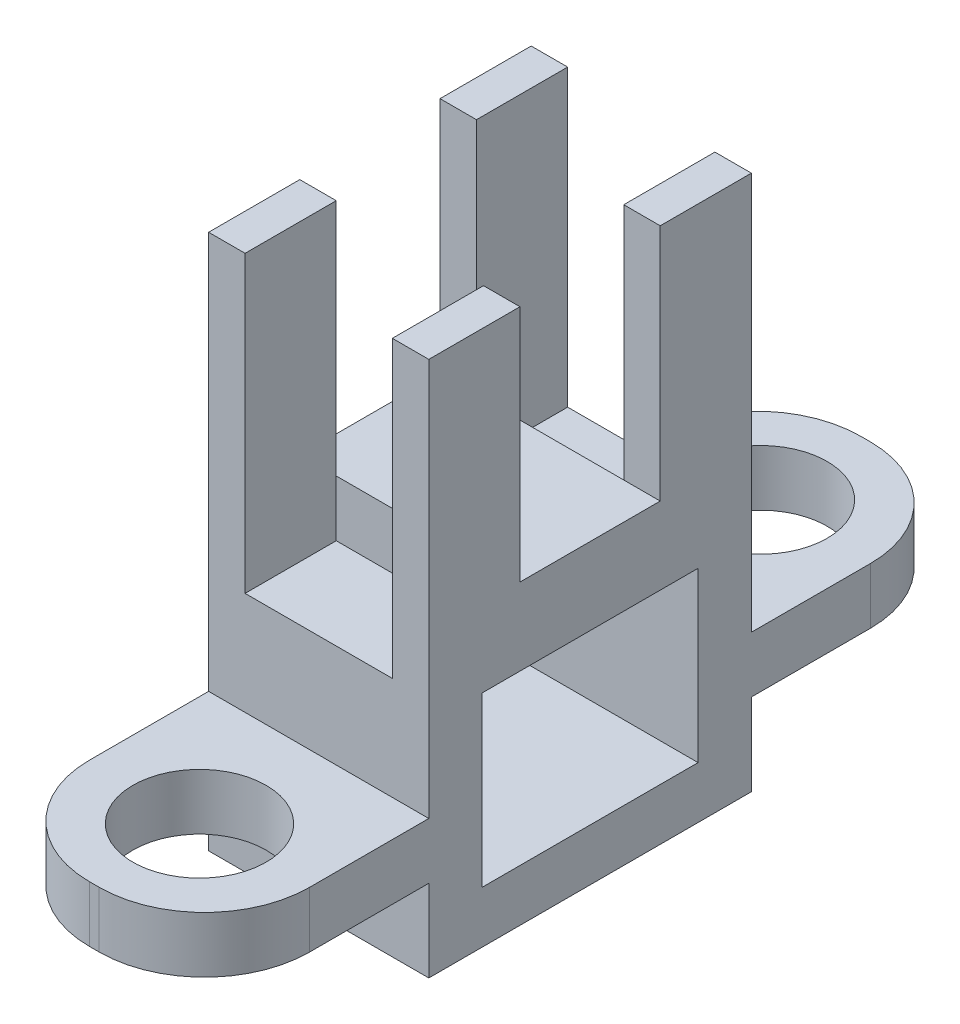
from build123d import *

# Parameters (mm, degrees)
SKETCH4_W             = 31.4
SKETCH4_H             = 31.4
SKETCH4_W_2           = 25.4
SKETCH4_H_2           = 25.4
BOSS_EXTRUDE3_DEPTH   = 30
SKETCH5_W             = 31.4
SKETCH5_H             = 31.4
BOSS_EXTRUDE4_DEPTH   = 5
SKETCH6_W             = 31.4
SKETCH6_H             = 8
BOSS_EXTRUDE5_DEPTH   = 5
BOSS_EXTRUDE6_DEPTH   = 8
SKETCH8_R             = 9.5
BOSS_EXTRUDE7_DEPTH   = 8
SKETCH9_W             = 31.4
SKETCH9_H             = 10
BOSS_EXTRUDE8_DEPTH   = 5
SKETCH10_W            = 31.4
SKETCH10_H            = 10
BOSS_EXTRUDE9_DEPTH   = 11
SKETCH11_W            = 5.2
SKETCH11_H            = 10
BOSS_EXTRUDE10_DEPTH  = 40
BOSS_EXTRUDE11_DEPTH  = 3
SKETCH13_W            = 31.4
SKETCH13_H            = 31.4
CUT_EXTRUDE1_DEPTH    = 31.4
SKETCH14_W            = 31.4
SKETCH14_H            = 31.4
BOSS_EXTRUDE12_DEPTH  = 4
SKETCH16_W            = 31.4
SKETCH16_H            = 8
BOSS_EXTRUDE13_DEPTH  = 15.4
CUT_EXTRUDE3_START    = 8
SKETCH8_2_R           = 9.5
CUT_EXTRUDE3_DEPTH    = 24
SKETCH18_W            = 21
SKETCH18_H            = 13
CUT_EXTRUDE4_DEPTH    = 2
MIRROR2_START         = -15.7
MIRROR2_DEPTH         = 34.4
MIRROR2_START_2       = 12.7
MIRROR2_2_OUTLINE_W   = 5.2
MIRROR2_2_OUTLINE_H   = 13
MIRROR2_2_DEPTH       = 48
MIRROR2_START_3       = -4
MIRROR2_3_OUTLINE_R   = 9.5
MIRROR2_3_DEPTH       = 8
MIRROR2_4_OUTLINE_W   = 31.4
MIRROR2_4_OUTLINE_H   = 10
MIRROR2_4_DEPTH       = 14
MIRROR2_5_OUTLINE_W   = 25.4
MIRROR2_5_OUTLINE_H   = 15.4
MIRROR2_5_DEPTH       = 8
MIRROR2_6_OUTLINE_W   = 21
MIRROR2_6_OUTLINE_H   = 5.4
MIRROR2_6_OUTLINE_W_2 = 25.4
MIRROR2_6_OUTLINE_H_2 = 12
MIRROR2_6_DEPTH       = 6
SKETCH17_W            = 30.8
SKETCH17_H            = 24
CUT_EXTRUDE2_DEPTH    = 31.4


# Read off the part's stored shape, not the designer's step: Mirror2
with BuildPart() as part:
    # Sketch4 → Boss-Extrude3 (new body)
    with BuildSketch(Plane.XY):
        Rectangle(SKETCH4_W, SKETCH4_H)
        Rectangle(SKETCH4_W_2, SKETCH4_H_2, mode=Mode.SUBTRACT)
    extrude(amount=BOSS_EXTRUDE3_DEPTH)

    # Sketch5 → Boss-Extrude4 (add)
    with BuildSketch(Plane.XY.offset(30)):
        Rectangle(SKETCH5_W, SKETCH5_H)
    extrude(amount=BOSS_EXTRUDE4_DEPTH)

    # Sketch6 → Boss-Extrude5 (add)
    with BuildSketch(Plane.XY.offset(35)):
        Rectangle(SKETCH6_W, SKETCH6_H)
    extrude(amount=BOSS_EXTRUDE5_DEPTH)

    # Sketch7 → Boss-Extrude6 (add)
    with BuildSketch(Plane.XZ.offset(4)):
        with BuildLine():
            Line((-15.7, 40), (-15.7, 52))
            ThreePointArc((-15.7, 52), (-11.306601718, 62.606601718), (-0.7, 67))
            Line((-0.7, 67), (0.7, 67))
            ThreePointArc((0.7, 67), (11.306601718, 62.606601718), (15.7, 52))
            Line((15.7, 52), (15.7, 40))
            Line((15.7, 40), (-15.7, 40))
        make_face()
    extrude(amount=-BOSS_EXTRUDE6_DEPTH)

    # Sketch8 → Boss-Extrude7 (add)
    with BuildSketch(Plane.XZ.offset(4)):
        with Locations(Location((0, 52, 0), (0, 0, 180))):
            Circle(SKETCH8_R)
    boss_extrude7 = extrude(amount=BOSS_EXTRUDE7_DEPTH)

    # Mirror1: Boss-Extrude7 across plane
    add(boss_extrude7.mirror(Plane.ZX))

    # Sketch9 → Boss-Extrude8 (add)
    with BuildSketch(Plane(origin=(0, 15.7, 0), x_dir=(1, 0, 0), z_dir=(0, 1, 0))):
        with Locations((0, -27)):
            Rectangle(SKETCH9_W, SKETCH9_H)
    extrude(amount=BOSS_EXTRUDE8_DEPTH)

    # Sketch10 → Boss-Extrude9 (add)
    with BuildSketch(Plane(origin=(0, 15.7, 0), x_dir=(1, 0, 0), z_dir=(0, 1, 0))):
        with Locations((0, -17)):
            Rectangle(SKETCH10_W, SKETCH10_H)
    extrude(amount=BOSS_EXTRUDE9_DEPTH)

    # Sketch11 → Boss-Extrude10 (add)
    with BuildSketch(Plane(origin=(0, 20.7, 0), x_dir=(1, 0, 0), z_dir=(0, 1, 0))):
        with Locations((-13.1, -27)):
            Rectangle(SKETCH11_W, SKETCH11_H)
        with Locations((13.1, -27)):
            Rectangle(SKETCH11_W, SKETCH11_H)
    extrude(amount=BOSS_EXTRUDE10_DEPTH)

    # Sketch12 → Boss-Extrude11 (add)
    with BuildSketch(Plane.XY.offset(32)):
        Polygon((-15.7, 60.7), (-10.5, 60.7), (-10.5, 20.7), (10.5, 20.7), (10.5, 60.7), (15.7, 60.7), (15.7, 15.7), (-15.7, 15.7), align=None)
    extrude(amount=BOSS_EXTRUDE11_DEPTH)

    # Sketch13 → Cut-Extrude1 (cut)
    with BuildSketch(Plane.ZY.offset(15.7)):
        with Locations((15.7, 0)):
            Rectangle(SKETCH13_W, SKETCH13_H)
    extrude(amount=-CUT_EXTRUDE1_DEPTH, mode=Mode.SUBTRACT)

    # Sketch14 → Boss-Extrude12 (add)
    with BuildSketch(Plane(origin=(0, 0, 31.4), x_dir=(-1, 0, 0), z_dir=(0, 0, -1))):
        Rectangle(SKETCH14_W, SKETCH14_H)
    extrude(amount=BOSS_EXTRUDE12_DEPTH)

    # Sketch16 → Boss-Extrude13 (add)
    with BuildSketch(Plane(origin=(0, 0, 27.4), x_dir=(-1, 0, 0), z_dir=(0, 0, -1))):
        with Locations((0, -11.7)):
            Rectangle(SKETCH16_W, SKETCH16_H)
    extrude(amount=BOSS_EXTRUDE13_DEPTH)

    # Sketch8<2> → Cut-Extrude3 (cut)
    with BuildSketch(Plane.XZ.offset(4).offset(CUT_EXTRUDE3_START)):
        with Locations(Location((0, 52, 0), (0, 0, 270))):
            Circle(SKETCH8_2_R)
    extrude(amount=-CUT_EXTRUDE3_DEPTH, mode=Mode.SUBTRACT)

    # Sketch18 → Cut-Extrude4 (cut)
    with BuildSketch(Plane(origin=(0, 20.7, 0), x_dir=(1, 0, 0), z_dir=(0, 1, 0))):
        with Locations((0, -28.5)):
            Rectangle(SKETCH18_W, SKETCH18_H)
    extrude(amount=-CUT_EXTRUDE4_DEPTH, mode=Mode.SUBTRACT)

    # Mirror2 outline → Mirror2 (add)
    with BuildSketch(Plane(origin=(0, 0, 0), x_dir=(1, 0, 0), z_dir=(0, 1, 0)).offset(MIRROR2_START)):
        Polygon((-15.7, 11), (-15.7, -24), (-12.7, -24), (-12.7, 3.4), (12.7, 3.4), (12.7, -24), (15.7, -24), (15.7, 11), align=None)
    extrude(amount=MIRROR2_DEPTH)

    # Mirror2 2 outline → Mirror2 2 (add)
    with BuildSketch(Plane(origin=(0, 0, 0), x_dir=(1, 0, 0), z_dir=(0, 1, 0)).offset(MIRROR2_START_2)):
        with Locations((-13.1, 4.5)):
            Rectangle(MIRROR2_2_OUTLINE_W, MIRROR2_2_OUTLINE_H)
        with Locations((13.1, 4.5)):
            Rectangle(MIRROR2_2_OUTLINE_W, MIRROR2_2_OUTLINE_H)
    extrude(amount=MIRROR2_2_DEPTH)

    # Mirror2 3 outline → Mirror2 3 (add)
    with BuildSketch(Plane(origin=(0, 0, 0), x_dir=(1, 0, 0), z_dir=(0, 1, 0)).offset(MIRROR2_START_3)):
        with BuildLine():
            Line((-15.7, 28), (-15.7, 11))
            Line((-15.7, 11), (15.7, 11))
            Line((15.7, 11), (15.7, 28))
            ThreePointArc((15.7, 28), (11.306601718, 38.606601718), (0.7, 43))
            Line((0.7, 43), (-0.7, 43))
            ThreePointArc((-0.7, 43), (-11.306601718, 38.606601718), (-15.7, 28))
        make_face()
        with Locations((0, 28)):
            Circle(MIRROR2_3_OUTLINE_R, mode=Mode.SUBTRACT)
    extrude(amount=MIRROR2_3_DEPTH)

    # Mirror2 4 outline → Mirror2 4 (add)
    with BuildSketch(Plane(origin=(0, 0, 0), x_dir=(1, 0, 0), z_dir=(0, 1, 0)).offset(MIRROR2_START_2)):
        with Locations((0, -7)):
            Rectangle(MIRROR2_4_OUTLINE_W, MIRROR2_4_OUTLINE_H)
    extrude(amount=MIRROR2_4_DEPTH)

    # Mirror2 5 outline → Mirror2 5 (add)
    with BuildSketch(Plane(origin=(0, 0, 0), x_dir=(1, 0, 0), z_dir=(0, 1, 0)).offset(MIRROR2_START)):
        with Locations((0, -4.3)):
            Rectangle(MIRROR2_5_OUTLINE_W, MIRROR2_5_OUTLINE_H)
    extrude(amount=MIRROR2_5_DEPTH)

    # Mirror2 6 outline → Mirror2 6 (add)
    with BuildSketch(Plane(origin=(0, 0, 0), x_dir=(1, 0, 0), z_dir=(0, 1, 0)).offset(MIRROR2_START_2)):
        with Locations((0, 0.7)):
            Rectangle(MIRROR2_6_OUTLINE_W, MIRROR2_6_OUTLINE_H)
        with Locations((0, -18)):
            Rectangle(MIRROR2_6_OUTLINE_W_2, MIRROR2_6_OUTLINE_H_2)
    extrude(amount=MIRROR2_6_DEPTH)

    # Sketch17 → Cut-Extrude2 (cut)
    with BuildSketch(Plane.ZY.offset(15.7)):
        with Locations((12, 3.7)):
            Rectangle(SKETCH17_W, SKETCH17_H)
    extrude(amount=-CUT_EXTRUDE2_DEPTH, mode=Mode.SUBTRACT)


solid = part.part
